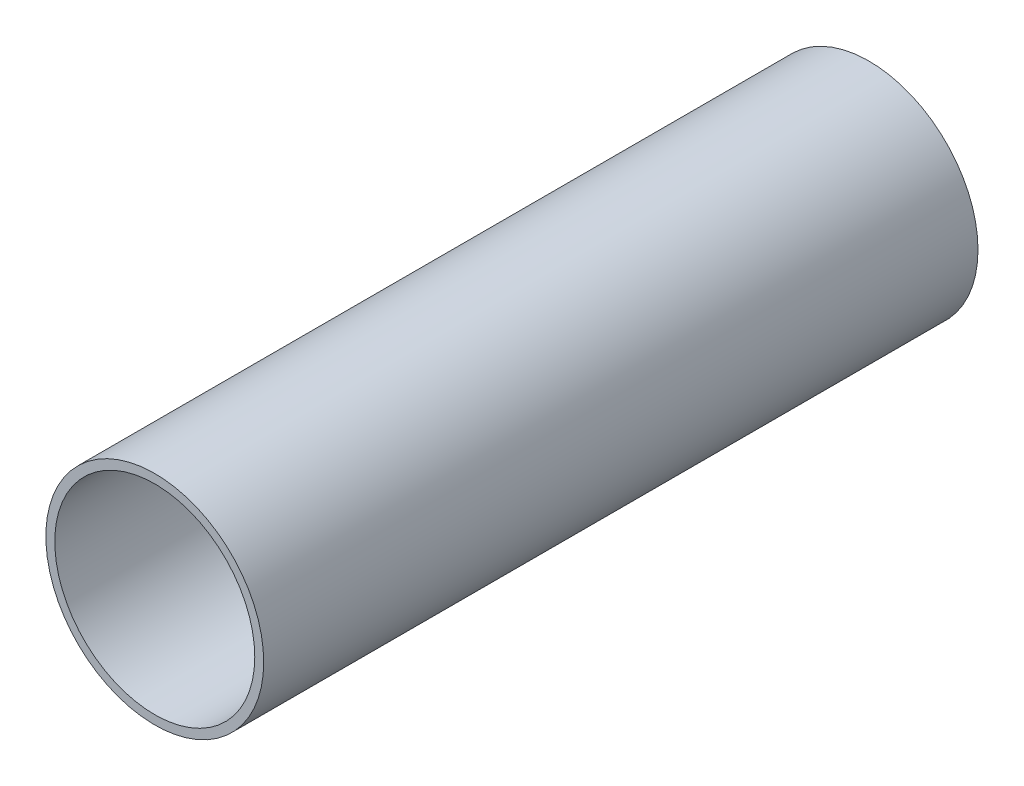
from build123d import *

# Parameters (mm, degrees)
SKETCH_1_R      = 15.25
SKETCH_1_R_2    = 14
EXTRUDE_1_DEPTH = 50


with BuildPart() as part:
    # 草图1 → 凸台-拉伸1 (new, symmetric)
    with BuildSketch(Plane.XY):
        Circle(SKETCH_1_R)
        Circle(SKETCH_1_R_2, mode=Mode.SUBTRACT)
    extrude(amount=EXTRUDE_1_DEPTH, both=True)


solid = part.part
